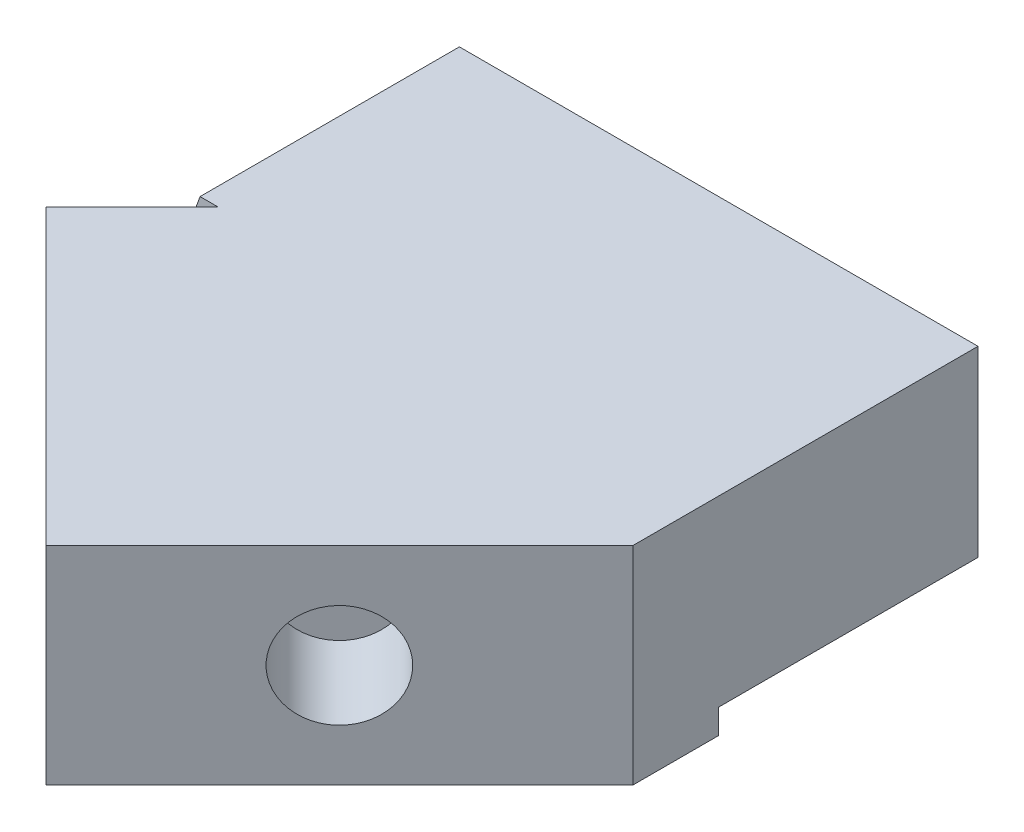
from build123d import *

# Parameters (mm, degrees)
BOSS_EXTRUDE1_DEPTH             = 12.7
SKETCH2_R                       = 6.35
CUT_EXTRUDE1_DEPTH              = 12.7
SKETCH3_R                       = 6.35
CUT_EXTRUDE2_DEPTH              = 12.7
CUT_EXTRUDE3_DEPTH              = 57.796126628
BOSS_EXTRUDE2_REACH             = 62.071
BOSS_EXTRUDE2_DIRECTION_2_DEPTH = 31.75
SKETCH6_R                       = 6.35
CUT_EXTRUDE4_DEPTH              = 81.372576281
CUT_EXTRUDE5_DEPTH              = 31.75


with BuildPart() as part:
    # Sketch1 → Boss-Extrude1 (new, symmetric)
    with BuildSketch(Plane(origin=(0, 0, 0), x_dir=(1, 0, 0), z_dir=(0, 1, 0))):
        Polygon((-35.921024484, 0), (0, 35.921024484), (35.921024484, 0), (0, -35.921024484), align=None)
    extrude(amount=BOSS_EXTRUDE1_DEPTH, both=True)

    # Sketch2 → Cut-Extrude1 (cut)
    with BuildSketch(Plane(origin=(17.960512242, 0, 17.960512242), x_dir=(0.7071067811865476, 0, -0.7071067811865476), z_dir=(0.7071067811865476, 0, 0.7071067811865476))):
        Circle(SKETCH2_R)
    extrude(amount=-CUT_EXTRUDE1_DEPTH, mode=Mode.SUBTRACT)

    # Sketch3 → Cut-Extrude2 (cut)
    with BuildSketch(Plane(origin=(-17.960512242, 0, 17.960512242), x_dir=(0.7071067811865472, 0, 0.7071067811865478), z_dir=(-0.7071067811865478, 0, 0.7071067811865472))):
        Circle(SKETCH3_R)
    extrude(amount=-CUT_EXTRUDE2_DEPTH, mode=Mode.SUBTRACT)

    # Sketch4 → Cut-Extrude3 (cut, through all)
    with BuildSketch(Plane(origin=(0, 12.7, 0), x_dir=(1, 0, 0), z_dir=(0, 1, 0))):
        Polygon((25.4, 10.521024484), (-25.4, 10.521024484), (0, 35.921024484), align=None)
    extrude(amount=-CUT_EXTRUDE3_DEPTH, mode=Mode.SUBTRACT)

    # Boss-Extrude2: up to this face of the body (flat: up to its plane)
    boss_extrude2_end = Plane(part.part.faces().sort_by_distance((30.660512242, 0, -5.260512242))[0])
    # Sketch5 → Boss-Extrude2 (add, up to the picked face)
    with BuildSketch(Plane(origin=(0, 0, -10.521024484), x_dir=(-1, 0, 0), z_dir=(0, 0, -1)), mode=Mode.PRIVATE) as boss_extrude2_sk1:
        Polygon((-35.921024484, 12.7), (-35.921024484, -12.7), (36.823819466, -12.7), (27.578975516, 12.7), align=None)
    boss_extrude2_tool1 = split(extrude(boss_extrude2_sk1.sketch, amount=-BOSS_EXTRUDE2_REACH, mode=Mode.PRIVATE), bisect_by=boss_extrude2_end, keep=Keep.BOTH, mode=Mode.PRIVATE)
    add(boss_extrude2_tool1.solids().sort_by(Axis((1.807538, -0.287251, -10.521024), (0, 0, 1)))[0])

    # Sketch5 → Boss-Extrude2 direction 2 (add)
    with BuildSketch(Plane(origin=(0, 0, -10.521024484), x_dir=(-1, 0, 0), z_dir=(0, 0, -1))):
        Polygon((-35.921024484, 12.7), (-35.921024484, -12.7), (36.823819466, -12.7), (27.578975516, 12.7), align=None)
    extrude(amount=BOSS_EXTRUDE2_DIRECTION_2_DEPTH)

    # Sketch6 → Cut-Extrude4 (cut, through all)
    with BuildSketch(Plane(origin=(-28.43454955, 10.349329661, 0), x_dir=(0, 0, 1), z_dir=(-0.9396926207859072, 0.3420201433256724, 0))):
        with Locations((-26.396024484, -11.013526585)):
            Circle(SKETCH6_R)
    extrude(amount=-CUT_EXTRUDE4_DEPTH, mode=Mode.SUBTRACT)

    # Sketch7 → Cut-Extrude5 (cut)
    with BuildSketch(Plane(origin=(0, 0, -42.271024484), x_dir=(-1, 0, 0), z_dir=(0, 0, -1))):
        Polygon((-44.198341153, -12.7), (21.37897897, 11.168192568), (30.066290611, -12.7), align=None)
    extrude(amount=-CUT_EXTRUDE5_DEPTH, mode=Mode.SUBTRACT)


solid = part.part
